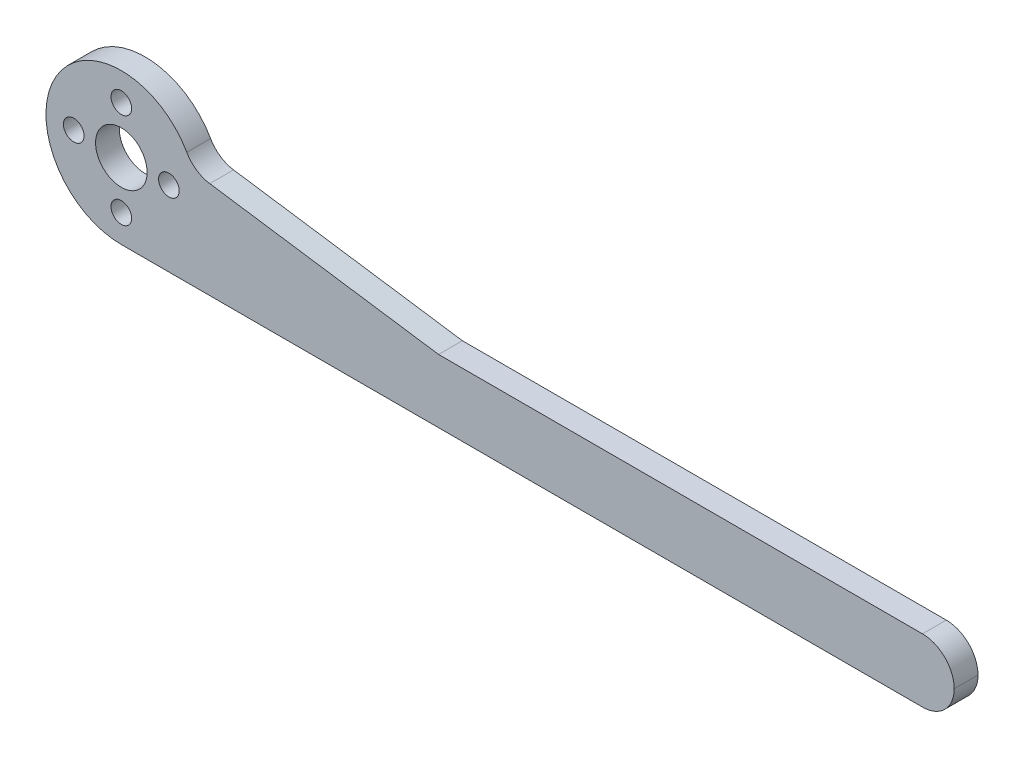
from build123d import *

# Parameters (mm, degrees)
ESQUISSE1_R        = 9.5
ESQUISSE1_R_2      = 1.3
ESQUISSE1_R_3      = 3.25
BOSS_EXTRU_1_DEPTH = 3
BOSS_EXTRU_2_DEPTH = 3
ESQUISSE3_W        = 65
ESQUISSE3_H        = 8
BOSS_EXTRU_3_DEPTH = 3
CONG_1_R           = 4


with BuildPart() as part:
    # Esquisse1 → Boss.-Extru.1 (new body)
    with BuildSketch(Plane.XY):
        Circle(ESQUISSE1_R)
        with Locations((6, 0)):
            Circle(ESQUISSE1_R_2, mode=Mode.SUBTRACT)
        with Locations((0, 6)):
            Circle(ESQUISSE1_R_2, mode=Mode.SUBTRACT)
        with Locations(Location((-6, 0, 0), (0, 0, 180))):
            Circle(ESQUISSE1_R_2, mode=Mode.SUBTRACT)
        with Locations(Location((0, -6, 0), (0, 0, 180))):
            Circle(ESQUISSE1_R_2, mode=Mode.SUBTRACT)
        Circle(ESQUISSE1_R_3, mode=Mode.SUBTRACT)
    extrude(amount=BOSS_EXTRU_1_DEPTH)

    # Esquisse2 → Boss.-Extru.2 (add)
    with BuildSketch(Plane.XY.offset(3)):
        Polygon((0, -9.5), (40, -9.5), (40, -1.5), (9, 3.041381265), (9, -0.5), align=None)
    extrude(amount=-BOSS_EXTRU_2_DEPTH)

    # Esquisse3 → Boss.-Extru.3 (add)
    with BuildSketch(Plane.XY.offset(3)):
        with Locations((72.5, -5.5)):
            Rectangle(ESQUISSE3_W, ESQUISSE3_H)
    extrude(amount=-BOSS_EXTRU_3_DEPTH)

    # Congé1
    cong_1_edges = [part.edges().sort_by_distance(p)[0] for p in [
        (9, 3.041381265, 1.5),
        (105, -9.5, 1.5),
        (105, -1.5, 1.5),
    ]]
    fillet(cong_1_edges, radius=CONG_1_R - 0.0001)  # a hair under: the kernel refuses the full size


solid = part.part
